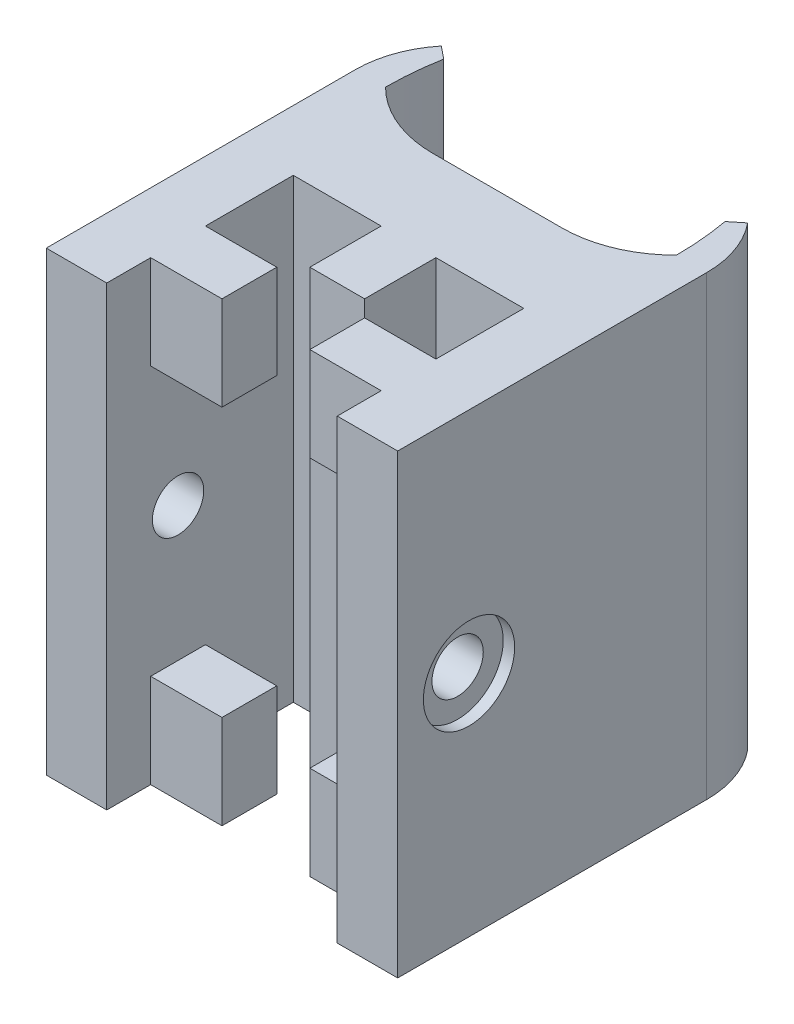
from build123d import *

# Parameters (mm, degrees)
BOSS_EXTRU_1_DEPTH                                = 20
CHAMBRAGE_POUR_VIS_SIX_PANS_CREUX_M41_D           = 4.5
CHAMBRAGE_POUR_VIS_SIX_PANS_CREUX_M41_DEPTH       = 11.55
CHAMBRAGE_POUR_VIS_SIX_PANS_CREUX_M41_CBORE_D     = 8
CHAMBRAGE_POUR_VIS_SIX_PANS_CREUX_M41_CBORE_DEPTH = 1
ESQUISSE6_W                                       = 20.2
ESQUISSE6_H                                       = 23.55054775
ENL_V_MAT_EXTRU_1_DEPTH                           = 3
BOSS_EXTRU_3_DEPTH                                = 40
CONG_1_R                                          = 10


with BuildPart() as part:
    # Base → Boss.-Extru.1 (new, symmetric)
    with BuildSketch(Plane(origin=(0, 0, 0), x_dir=(1, 0, 0), z_dir=(0, 1, 0))):
        Polygon((-3.85, -2.4), (-3.85, 2.4), (-10.1, 2.4), (-10.1, 10.1), (-2.4, 10.1), (-2.4, 3.85), (2.4, 3.85), (2.4, 10.1), (10.1, 10.1), (10.1, 2.4), (3.85, 2.4), (3.85, -2.4), (10.1, -2.4), (10.1, -6.25), (15.4, -6.25), (15.4, 15.4), (-15.4, 15.4), (-15.4, -6.25), (-10.1, -6.25), (-10.1, -2.4), align=None)
    extrude(amount=BOSS_EXTRU_1_DEPTH, both=True)

    # Chambrage pour vis à six pans creux M41
    with Locations(Plane(origin=(15.4, 0, 0), x_dir=(0, 0, -1), z_dir=(1, 0, 0))):
        with Locations((0, 0)):
            chambrage_pour_vis_six_pans_creux_m41 = CounterBoreHole(CHAMBRAGE_POUR_VIS_SIX_PANS_CREUX_M41_D / 2, CHAMBRAGE_POUR_VIS_SIX_PANS_CREUX_M41_CBORE_D / 2, CHAMBRAGE_POUR_VIS_SIX_PANS_CREUX_M41_CBORE_DEPTH, depth=CHAMBRAGE_POUR_VIS_SIX_PANS_CREUX_M41_DEPTH)

    # Symétrie1: Chambrage pour vis à six pans creux M41 across plane
    add(chambrage_pour_vis_six_pans_creux_m41.mirror(Plane(origin=(0, 0, 0), x_dir=(0, 0, 1), z_dir=(1, 0, 0))), mode=Mode.SUBTRACT)

    # Esquisse6 → Enlèv. mat.-Extru.1 (cut, symmetric)
    with BuildSketch(Plane.XY):
        Rectangle(ESQUISSE6_W, ESQUISSE6_H)
    extrude(amount=ENL_V_MAT_EXTRU_1_DEPTH, both=True, mode=Mode.SUBTRACT)

    # Esquisse14 → Boss.-Extru.3 (add)
    with BuildSketch(Plane.XZ.offset(20)):
        with BuildLine():
            Line((-15.4, -15.4), (15.4, -15.4))
            Line((15.4, -15.4), (15.4, -17.9))
            Line((15.4, -17.9), (15.4, -20.835156926))
            ThreePointArc((15.4, -20.835156926), (14.892113101, -23.787279745), (13.42685396, -26.399940055))
            Line((13.42685396, -26.399940055), (12.329607692, -25.509925555))
            ThreePointArc((12.329607692, -25.509925555), (12.644690295, -23.181973462), (12.75, -20.835156926))
            Line((12.75, -20.835156926), (12.75, -17.87758102))
            Line((12.75, -17.87758102), (-12.75, -17.87758102))
            Line((-12.75, -17.87758102), (-12.75, -20.835156926))
            ThreePointArc((-12.75, -20.835156926), (-12.644690295, -23.181973462), (-12.329607692, -25.509925555))
            Line((-12.329607692, -25.509925555), (-13.42685396, -26.399940055))
            ThreePointArc((-13.42685396, -26.399940055), (-14.892113101, -23.787279745), (-15.4, -20.835156926))
            Line((-15.4, -20.835156926), (-15.4, -17.9))
            Line((-15.4, -17.9), (-15.4, -15.4))
        make_face()
    extrude(amount=-BOSS_EXTRU_3_DEPTH)

    # Congé1
    # the kernel refuses this fillet: 10 mm, written as the material it adds along each edge
    with BuildSketch(Plane(origin=(-12.75, -20, -17.87758102), x_dir=(0, 0, -1), z_dir=(0, 1, 0))) as cong_1_piece_1:
        with BuildLine():
            CenterArc((10, -7.099595966), CONG_1_R, 134.768371909, 45.231628091)
            Line((0, -7.099595966), (0, 0))
            Line((0, 0), (2.957575906, 0))
        make_face()
    extrude(amount=40)
    with BuildSketch(Plane(origin=(12.75, -20, -17.87758102), x_dir=(-1, 0, 0), z_dir=(0, 1, 0))) as cong_1_piece_2:
        with BuildLine():
            CenterArc((7.099595966, -10), CONG_1_R, 90, 45.231628091)
            Line((0, -2.957575906), (0, 0))
            Line((0, 0), (7.099595966, 0))
        make_face()
    extrude(amount=40)


solid = part.part
